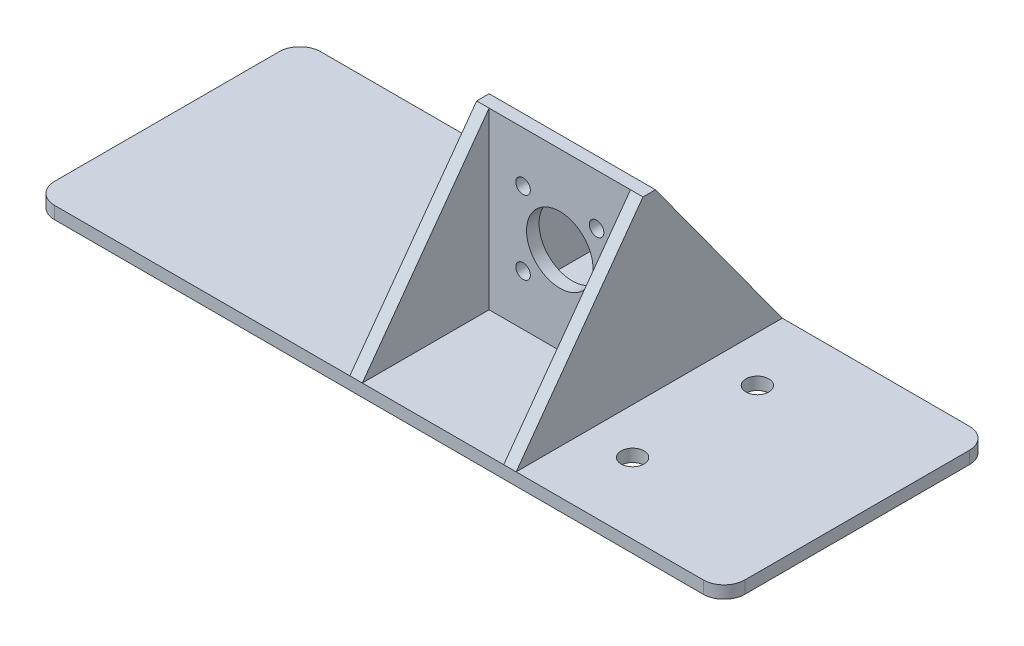
from build123d import *

# Parameters (mm, degrees)
BOSS_EXTRUDE1_DEPTH      = 3
SKETCH2_R                = 2.75
CUT_EXTRUDE1_DEPTH       = 90.0056178
SKETCH3_W                = 40
SKETCH3_H                = 3
BOSS_EXTRUDE2_DEPTH      = 42
CUT_EXTRUDE2_DEPTH       = 101.181086039
CUT_EXTRUDE2_DEPTH_BACK  = 101.181086039
SKETCH6_R                = 8
SKETCH6_R_2              = 1.75
BOSS_EXTRUDE3_DEPTH      = 30.5
BOSS_EXTRUDE3_DEPTH_BACK = 33.5
SKETCH7_W                = 3
SKETCH7_H                = 42
CUT_EXTRUDE5_DEPTH       = 106.588825166
CUT_EXTRUDE5_DEPTH_BACK  = 106.588825166


with BuildPart() as part:
    # Sketch1 → Boss-Extrude1 (new body)
    with BuildSketch(Plane(origin=(0, 0, 0), x_dir=(1, 0, 0), z_dir=(0, 1, 0))):
        with BuildLine():
            Line((78, 32), (-78, 32))
            ThreePointArc((-78, 32), (-81.535533906, 30.535533906), (-83, 27))
            Line((-83, 27), (-83, -27))
            ThreePointArc((-83, -27), (-81.535533906, -30.535533906), (-78, -32))
            Line((-78, -32), (78, -32))
            ThreePointArc((78, -32), (81.535533906, -30.535533906), (83, -27))
            Line((83, -27), (83, 27))
            ThreePointArc((83, 27), (81.535533906, 30.535533906), (78, 32))
        make_face()
    extrude(amount=BOSS_EXTRUDE1_DEPTH)

    # Sketch2 → Cut-Extrude1 (cut, through all)
    with BuildSketch(Plane(origin=(0, 3, 0), x_dir=(1, 0, 0), z_dir=(0, 1, 0))):
        with Locations((44, -15)):
            Circle(SKETCH2_R)
        with Locations((44, 15)):
            Circle(SKETCH2_R)
        with Locations((-18, 0)):
            Circle(SKETCH2_R)
    extrude(amount=-CUT_EXTRUDE1_DEPTH, mode=Mode.SUBTRACT)

    # Sketch3 → Boss-Extrude2 (add)
    with BuildSketch(Plane(origin=(0, 3, 0), x_dir=(1, 0, 0), z_dir=(0, 1, 0))):
        with Locations((13, 0)):
            Rectangle(SKETCH3_W, SKETCH3_H)
    extrude(amount=BOSS_EXTRUDE2_DEPTH)

    # Sketch6 → Cut-Extrude2 (cut, two sides: drawn at the far end of the back side and taken through both)
    with BuildSketch(Plane(origin=(0, 0, -1.5), x_dir=(-1, 0, 0), z_dir=(0, 0, -1)).offset(-CUT_EXTRUDE2_DEPTH_BACK)):
        with Locations((-13, 24)):
            Circle(SKETCH6_R)
        with Locations((-4.161165235, 15.161165235)):
            Circle(SKETCH6_R_2)
        with Locations((-21.838834765, 15.161165235)):
            Circle(SKETCH6_R_2)
        with Locations((-21.838834765, 32.838834765)):
            Circle(SKETCH6_R_2)
        with Locations((-4.161165235, 32.838834765)):
            Circle(SKETCH6_R_2)
    extrude(amount=CUT_EXTRUDE2_DEPTH + CUT_EXTRUDE2_DEPTH_BACK, mode=Mode.SUBTRACT)

    # Sketch7 → Boss-Extrude3 (add, two sides: drawn at the far end of the back side and taken through both)
    with BuildSketch(Plane(origin=(0, 0, -1.5), x_dir=(-1, 0, 0), z_dir=(0, 0, -1)).offset(-BOSS_EXTRUDE3_DEPTH_BACK)):
        with Locations((-31.5, 24)):
            Rectangle(SKETCH7_W, SKETCH7_H)
        with Locations((5.5, 24)):
            Rectangle(SKETCH7_W, SKETCH7_H)
    extrude(amount=BOSS_EXTRUDE3_DEPTH + BOSS_EXTRUDE3_DEPTH_BACK)

    # Sketch8 → Cut-Extrude5 (cut, two sides: drawn at the far end of the back side and taken through both)
    with BuildSketch(Plane.ZY.offset(7).offset(-CUT_EXTRUDE5_DEPTH_BACK)):
        Polygon((-1.5, 45), (-32, 3), (-32, 45), align=None)
        Polygon((1.5, 45), (32, 3), (32, 45), align=None)
    extrude(amount=CUT_EXTRUDE5_DEPTH + CUT_EXTRUDE5_DEPTH_BACK, mode=Mode.SUBTRACT)


solid = part.part
